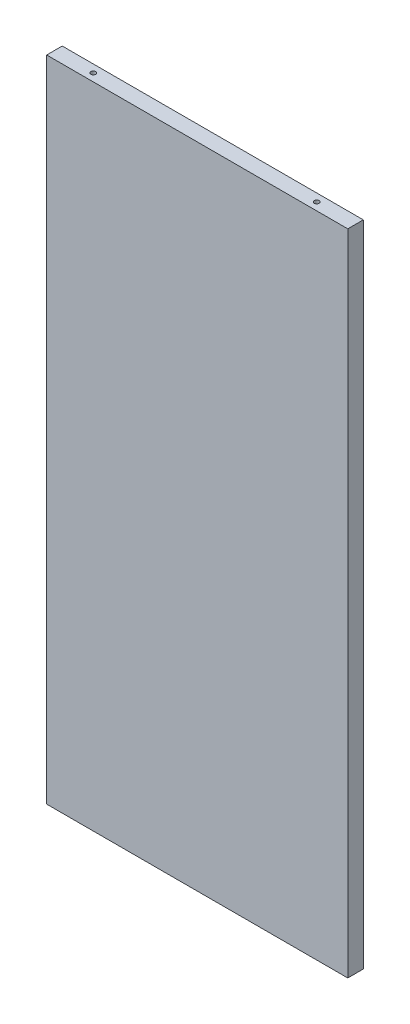
from build123d import *

# Parameters (mm, degrees)
SKETCH_1_W            = 310
SKETCH_1_H            = 668
EXTRUDE_5906_DEPTH    = 16
SKETCH_11_R           = 2.5
CUT_EXTRUDE_1_DEPTH   = 37
SKETCH_12_R           = 2.5
CUT_EXTRUDE_2_DEPTH   = 37
CUT_EXTRUDE_START     = -37
SKETCH_19_R           = 2.5
CUT_EXTRUDE_1_2_DEPTH = 37
SKETCH_20_R           = 2.5
CUT_EXTRUDE_2_2_DEPTH = 37


with BuildPart() as part:
    # Эскиз1 → Extrude 5906 (new body)
    with BuildSketch(Plane.XY):
        with Locations((155, 334)):
            Rectangle(SKETCH_1_W, SKETCH_1_H)
    extrude(amount=EXTRUDE_5906_DEPTH)

    # Эскиз11 → Cut-Extrude 1 (cut)
    with BuildSketch(Plane(origin=(0, 668, 0), x_dir=(1, 0, 0), z_dir=(0, 1, 0))):
        with Locations((40, -8)):
            Circle(SKETCH_11_R)
    extrude(amount=-CUT_EXTRUDE_1_DEPTH, mode=Mode.SUBTRACT)

    # Эскиз12 → Cut-Extrude 2 (cut)
    with BuildSketch(Plane(origin=(0, 668, 0), x_dir=(1, 0, 0), z_dir=(0, 1, 0))):
        with Locations((270, -8)):
            Circle(SKETCH_12_R)
    extrude(amount=-CUT_EXTRUDE_2_DEPTH, mode=Mode.SUBTRACT)

    # Эскиз19 → Cut-Extrude 1 2 (cut)
    with BuildSketch(Plane.XZ.offset(CUT_EXTRUDE_START)):
        with Locations((270, 8)):
            Circle(SKETCH_19_R)
    extrude(amount=CUT_EXTRUDE_1_2_DEPTH, mode=Mode.SUBTRACT)

    # Эскиз20 → Cut-Extrude 2 2 (cut)
    with BuildSketch(Plane.XZ.offset(CUT_EXTRUDE_START)):
        with Locations((40, 8)):
            Circle(SKETCH_20_R)
    extrude(amount=CUT_EXTRUDE_2_2_DEPTH, mode=Mode.SUBTRACT)


solid = part.part
